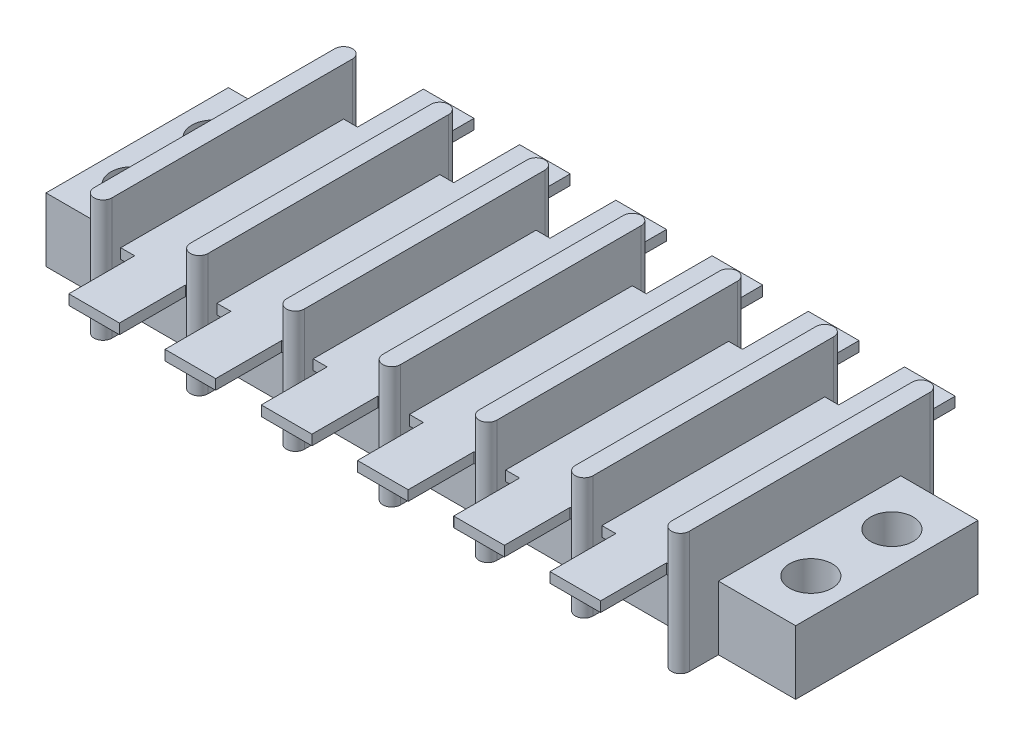
from build123d import *

# Parameters (mm, degrees)
SKETCH1_W           = 74
SKETCH1_H           = 18
BOSS_EXTRUDE1_DEPTH = 6.3
BOSS_EXTRUDE2_DEPTH = 12
BOSS_EXTRUDE3_DEPTH = 1
SKETCH6_R           = 2.1
CUT_EXTRUDE1_DEPTH  = 42.411834057


with BuildPart() as part:
    # Sketch1 → Boss-Extrude1 (new body)
    with BuildSketch(Plane(origin=(0, 0, 0), x_dir=(1, 0, 0), z_dir=(0, 1, 0))):
        Rectangle(SKETCH1_W, SKETCH1_H)
    extrude(amount=BOSS_EXTRUDE1_DEPTH)

    # Sketch4 → Boss-Extrude2 (add)
    with BuildSketch(Plane(origin=(0, 0, 0), x_dir=(1, 0, 0), z_dir=(0, 1, 0))):
        with BuildLine():
            Line((-27.625, 11.875), (-27.625, -11.875))
            ThreePointArc((-27.625, -11.875), (-28.5, -12.75), (-29.375, -11.875))
            Line((-29.375, -11.875), (-29.375, 11.875))
            ThreePointArc((-29.375, 11.875), (-28.5, 12.75), (-27.625, 11.875))
        make_face()
        with BuildLine():
            Line((-18.125, 11.875), (-18.125, -11.875))
            ThreePointArc((-18.125, -11.875), (-19, -12.75), (-19.875, -11.875))
            Line((-19.875, -11.875), (-19.875, 11.875))
            ThreePointArc((-19.875, 11.875), (-19, 12.75), (-18.125, 11.875))
        make_face()
        with BuildLine():
            Line((-8.625, 11.875), (-8.625, -11.875))
            ThreePointArc((-8.625, -11.875), (-9.5, -12.75), (-10.375, -11.875))
            Line((-10.375, -11.875), (-10.375, 11.875))
            ThreePointArc((-10.375, 11.875), (-9.5, 12.75), (-8.625, 11.875))
        make_face()
        with BuildLine():
            Line((0.875, 11.875), (0.875, -11.875))
            ThreePointArc((0.875, -11.875), (0, -12.75), (-0.875, -11.875))
            Line((-0.875, -11.875), (-0.875, 11.875))
            ThreePointArc((-0.875, 11.875), (0, 12.75), (0.875, 11.875))
        make_face()
        with BuildLine():
            Line((10.375, 11.875), (10.375, -11.875))
            ThreePointArc((10.375, -11.875), (9.5, -12.75), (8.625, -11.875))
            Line((8.625, -11.875), (8.625, 11.875))
            ThreePointArc((8.625, 11.875), (9.5, 12.75), (10.375, 11.875))
        make_face()
        with BuildLine():
            Line((19.875, 11.875), (19.875, -11.875))
            ThreePointArc((19.875, -11.875), (19, -12.75), (18.125, -11.875))
            Line((18.125, -11.875), (18.125, 11.875))
            ThreePointArc((18.125, 11.875), (19, 12.75), (19.875, 11.875))
        make_face()
        with BuildLine():
            Line((29.375, 11.875), (29.375, -11.875))
            ThreePointArc((29.375, -11.875), (28.5, -12.75), (27.625, -11.875))
            Line((27.625, -11.875), (27.625, 11.875))
            ThreePointArc((27.625, 11.875), (28.5, 12.75), (29.375, 11.875))
        make_face()
    extrude(amount=BOSS_EXTRUDE2_DEPTH)

    # Sketch5 → Boss-Extrude3 (add)
    with BuildSketch(Plane(origin=(0, 6.3, 0), x_dir=(1, 0, 0), z_dir=(0, 1, 0))):
        Polygon((-27.625, 11), (-26.25, 11), (-26.25, 17.5), (-21.25, 17.5), (-21.25, 11), (-19.875, 11), (-19.875, -11), (-21.25, -11), (-21.25, -17.5), (-26.25, -17.5), (-26.25, -11), (-27.625, -11), align=None)
        Polygon((-18.125, 11), (-16.75, 11), (-16.75, 17.5), (-11.75, 17.5), (-11.75, 11), (-10.375, 11), (-10.375, -11), (-11.75, -11), (-11.75, -17.5), (-16.75, -17.5), (-16.75, -11), (-18.125, -11), align=None)
        Polygon((-8.625, 11), (-7.25, 11), (-7.25, 17.5), (-2.25, 17.5), (-2.25, 11), (-0.875, 11), (-0.875, -11), (-2.25, -11), (-2.25, -17.5), (-7.25, -17.5), (-7.25, -11), (-8.625, -11), align=None)
        Polygon((0.875, 11), (2.25, 11), (2.25, 17.5), (7.25, 17.5), (7.25, 11), (8.625, 11), (8.625, -11), (7.25, -11), (7.25, -17.5), (2.25, -17.5), (2.25, -11), (0.875, -11), align=None)
        Polygon((10.375, 11), (11.75, 11), (11.75, 17.5), (16.75, 17.5), (16.75, 11), (18.125, 11), (18.125, -11), (16.75, -11), (16.75, -17.5), (11.75, -17.5), (11.75, -11), (10.375, -11), align=None)
        Polygon((19.875, 11), (21.25, 11), (21.25, 17.5), (26.25, 17.5), (26.25, 11), (27.625, 11), (27.625, -11), (26.25, -11), (26.25, -17.5), (21.25, -17.5), (21.25, -11), (19.875, -11), align=None)
    extrude(amount=BOSS_EXTRUDE3_DEPTH)

    # Sketch6 → Cut-Extrude1 (cut, through all)
    with BuildSketch(Plane(origin=(0, 6.3, 0), x_dir=(1, 0, 0), z_dir=(0, 1, 0))):
        with Locations((-33.5, 4)):
            Circle(SKETCH6_R)
        with Locations((-33.5, -4)):
            Circle(SKETCH6_R)
        with Locations((33.5, 4)):
            Circle(SKETCH6_R)
        with Locations((33.5, -4)):
            Circle(SKETCH6_R)
    extrude(amount=-CUT_EXTRUDE1_DEPTH, mode=Mode.SUBTRACT)


solid = part.part
